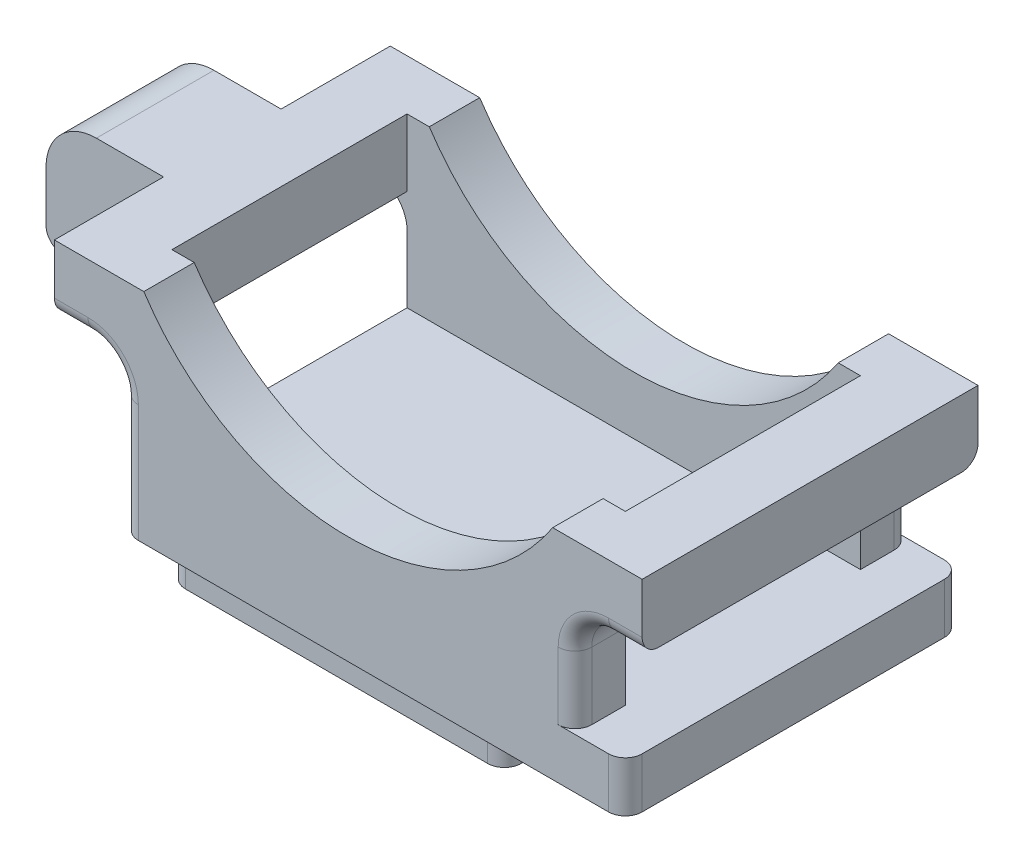
from build123d import *

# Parameters (mm, degrees)
SKETCH1_W            = 20
SKETCH1_H            = 14.4
BOSS_EXTRUDE1_DEPTH  = 1.8
SKETCH2_W            = 20
SKETCH2_H            = 10
BOSS_EXTRUDE2_DEPTH  = 2.1
SKETCH3_W            = 30
SKETCH3_H            = 20
BOSS_EXTRUDE3_DEPTH  = 3
SKETCH4_W            = 2
SKETCH4_H            = 15
BOSS_EXTRUDE4_DEPTH  = 0.8
FILLET1_R            = 1.5
SKETCH5_W            = 27
SKETCH5_H            = 3
BOSS_EXTRUDE6_DEPTH  = 10
CUT_EXTRUDE1_DEPTH   = 40.819718733
SKETCH7_W            = 20
SKETCH7_H            = 4
BOSS_EXTRUDE7_DEPTH  = 4
SKETCH8_W            = 20
SKETCH8_H            = 4
BOSS_EXTRUDE8_DEPTH  = 4
FILLET3_R            = 2
FILLET2_R            = 1
FILLET4_R            = 1
SKETCH10_W           = 7
SKETCH10_H           = 4
BOSS_EXTRUDE10_DEPTH = 7
SKETCH11_W           = 3
SKETCH11_H           = 7
BOSS_EXTRUDE11_DEPTH = 3
FILLET5_R            = 2
FILLET6_R            = 1
FILLET7_R            = 3


# Some blends are built 0.0001 mm under size
with BuildPart() as part:
    # Sketch1 → Boss-Extrude1 (new body)
    with BuildSketch(Plane(origin=(0, 0, 0), x_dir=(1, 0, 0), z_dir=(0, 1, 0))):
        with Locations((10, -7.2)):
            Rectangle(SKETCH1_W, SKETCH1_H)
    extrude(amount=BOSS_EXTRUDE1_DEPTH)

    # Sketch2 → Boss-Extrude2 (add)
    with BuildSketch(Plane(origin=(0, 1.8, 0), x_dir=(1, 0, 0), z_dir=(0, 1, 0))):
        with Locations((10, -7.2)):
            Rectangle(SKETCH2_W, SKETCH2_H)
    extrude(amount=BOSS_EXTRUDE2_DEPTH)

    # Sketch3 → Boss-Extrude3 (add)
    with BuildSketch(Plane(origin=(0, 3.9, 0), x_dir=(1, 0, 0), z_dir=(0, 1, 0))):
        with Locations((15, -7.2)):
            Rectangle(SKETCH3_W, SKETCH3_H)
    extrude(amount=BOSS_EXTRUDE3_DEPTH)

    # Sketch4 → Boss-Extrude4 (add)
    with BuildSketch(Plane(origin=(0, 3.9, 0), x_dir=(-1, 0, 0), z_dir=(0, -1, 0))):
        with Locations((-28, -7.2)):
            Rectangle(SKETCH4_W, SKETCH4_H)
    extrude(amount=BOSS_EXTRUDE4_DEPTH)

    # Fillet1
    # the kernel refuses this fillet: 1.5 mm, written as the material it takes off along each edge
    with BuildSketch(Plane(origin=(27, 3.1, -3.61662479), x_dir=(0, 1, 0), z_dir=(0, 0, 1))) as fillet1_piece_1:
        with BuildLine():
            CenterArc((1.5, -1.326649916), FILLET1_R, 117.818139285, 62.181860715)
            Line((0, -1.326649916), (-0.03, -1.326649916))
            Line((-0.03, -1.326649916), (-0.03, 0))
            Line((-0.03, 0), (0, 0.03))
            ThreePointArc((0, 0.03), (0.4, 0.03), (0.786, 0.026532998))
            Line((0.786, 0.026532998), (0.8, 0))
        make_face()
    extrude(amount=21.633249581, mode=Mode.SUBTRACT)

    # Sketch5 → Boss-Extrude6 (add)
    with BuildSketch(Plane(origin=(0, 6.9, 0), x_dir=(1, 0, 0), z_dir=(0, 1, 0))):
        with Locations((13.5, 1.3)):
            Rectangle(SKETCH5_W, SKETCH5_H)
        with Locations((13.5, -15.7)):
            Rectangle(SKETCH5_W, SKETCH5_H)
    extrude(amount=BOSS_EXTRUDE6_DEPTH)

    # Sketch6 → Cut-Extrude1 (cut, through all)
    with BuildSketch(Plane.XY.offset(17.2)):
        with BuildLine():
            Line((1.325139576, 16.9), (25.674860424, 16.9))
            ThreePointArc((25.674860424, 16.9), (13.5, 10.331979326), (1.325139576, 16.9))
        make_face()
    extrude(amount=-CUT_EXTRUDE1_DEPTH, mode=Mode.SUBTRACT)

    # Sketch7 → Boss-Extrude7 (add)
    with BuildSketch(Plane(origin=(27, 0, 0), x_dir=(0, 0, -1), z_dir=(1, 0, 0))):
        with Locations((-7.2, 14.9)):
            Rectangle(SKETCH7_W, SKETCH7_H)
    extrude(amount=BOSS_EXTRUDE7_DEPTH)

    # Sketch8 → Boss-Extrude8 (add)
    with BuildSketch(Plane.ZY):
        with Locations((7.2, 14.9)):
            Rectangle(SKETCH8_W, SKETCH8_H)
    extrude(amount=BOSS_EXTRUDE8_DEPTH)

    # Fillet3
    fillet3_edges = [part.edges().sort_by_distance(p)[0] for p in [
        (27, 12.9, 15.7),
        (27, 12.9, -1.3),
        (0, 12.9, 15.7),
        (0, 12.9, -1.3),
    ]]
    fillet(fillet3_edges, radius=FILLET3_R)

    # Fillet2
    fillet2_edges = [part.edges().sort_by_distance(p)[0] for p in [
        (-3, 12.9, -2.8),
        (-3, 12.9, 17.2),
        (0, 7.4, -2.8),
        (0, 7.4, 17.2),
        (-0.585786438, 12.314213562, 17.2),
        (-0.585786438, 12.314213562, -2.8),
        (30, 5.4, 17.2),
        (30, 5.4, -2.8),
        (0, 0.9, 0),
        (20, 0.9, 0),
        (20, 0.9, 14.4),
        (0, 0.9, 14.4),
    ]]
    fillet(fillet2_edges, radius=FILLET2_R)

    # Fillet4
    fillet4_edges = [part.edges().sort_by_distance(p)[0] for p in [
        (30, 12.9, 17.2),
        (30, 12.9, -2.8),
        (27, 8.9, -2.8),
        (27, 8.9, 17.2),
        (27.585786438, 12.314213562, -2.8),
        (27.585786438, 12.314213562, 17.2),
    ]]
    fillet(fillet4_edges, radius=FILLET4_R)

    # Sketch10 → Boss-Extrude10 (add)
    with BuildSketch(Plane.ZY.offset(4)):
        with Locations((7.2, 14.9)):
            Rectangle(SKETCH10_W, SKETCH10_H)
    extrude(amount=BOSS_EXTRUDE10_DEPTH)

    # Sketch11 → Boss-Extrude11 (add)
    with BuildSketch(Plane(origin=(0, 12.9, 0), x_dir=(-1, 0, 0), z_dir=(0, -1, 0))):
        with Locations((9.5, -7.2)):
            Rectangle(SKETCH11_W, SKETCH11_H)
    extrude(amount=BOSS_EXTRUDE11_DEPTH)

    # Fillet5
    fillet5_edges = [part.edges().sort_by_distance(p)[0] for p in [
        (-8, 12.9, 7.2),
    ]]
    fillet(fillet5_edges, radius=FILLET5_R)

    # Fillet6
    fillet6_edges = [part.edges().sort_by_distance(p)[0] for p in [
        (-11, 9.9, 7.2),
        (-8, 9.9, 7.2),
    ]]
    fillet(fillet6_edges, radius=FILLET6_R - 0.0001)  # a hair under: the kernel refuses the full size

    # Fillet7
    fillet7_edges = [part.edges().sort_by_distance(p)[0] for p in [
        (-11, 16.9, 7.2),
    ]]
    fillet(fillet7_edges, radius=FILLET7_R)


solid = part.part
